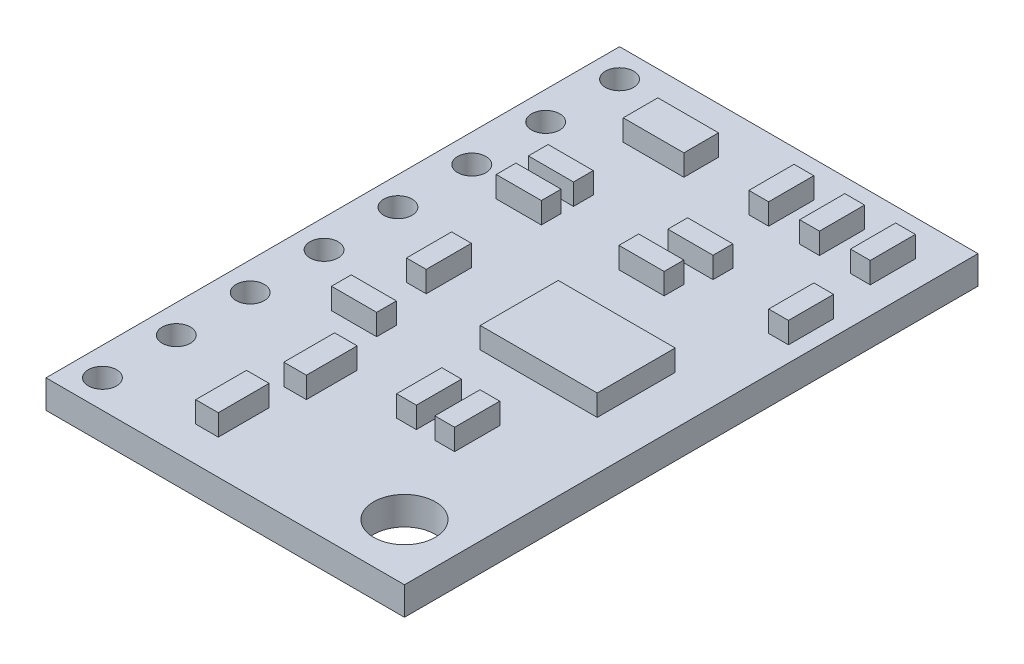
from build123d import *

# Parameters (mm, degrees)
SKETCH1_W           = 12.7
SKETCH1_H           = 20.32
BOSS_EXTRUDE1_DEPTH = 1
SKETCH2_R           = 0.5
SKETCH2_R_2         = 1.0922
CUT_EXTRUDE2_DEPTH  = 1
SKETCH3_W           = 0.7
SKETCH3_H           = 1.6
SKETCH3_W_2         = 2.149156966
SKETCH3_H_2         = 1.228089695
SKETCH3_W_3         = 4.14480272
SKETCH3_H_3         = 2.763201813
SKETCH3_W_4         = 0.8
SKETCH3_H_4         = 1.8
SKETCH3_W_5         = 1.6
SKETCH3_H_5         = 0.7
BOSS_EXTRUDE3_DEPTH = 0.75


with BuildPart() as part:
    # Sketch1 → Boss-Extrude1 (new body)
    with BuildSketch(Plane(origin=(0, 0, 0), x_dir=(1, 0, 0), z_dir=(0, 1, 0))):
        with Locations((6.35, 10.16)):
            Rectangle(SKETCH1_W, SKETCH1_H)
    extrude(amount=BOSS_EXTRUDE1_DEPTH)

    # Sketch2 → Cut-Extrude2 (cut)
    with BuildSketch(Plane(origin=(0, 1, 0), x_dir=(1, 0, 0), z_dir=(0, 1, 0))):
        with Locations((1, 19.32)):
            Circle(SKETCH2_R)
        with Locations((1, 16.702857143)):
            Circle(SKETCH2_R)
        with Locations((1, 14.085714286)):
            Circle(SKETCH2_R)
        with Locations((1, 11.468571429)):
            Circle(SKETCH2_R)
        with Locations((1, 8.851428571)):
            Circle(SKETCH2_R)
        with Locations((1, 6.234285714)):
            Circle(SKETCH2_R)
        with Locations((1, 3.617142857)):
            Circle(SKETCH2_R)
        with Locations((1, 1)):
            Circle(SKETCH2_R)
        with Locations((10.7, 2)):
            Circle(SKETCH2_R_2)
    extrude(amount=-CUT_EXTRUDE2_DEPTH, mode=Mode.SUBTRACT)

    # Sketch3 → Boss-Extrude3 (add)
    with BuildSketch(Plane(origin=(0, 1, 0), x_dir=(1, 0, 0), z_dir=(0, 1, 0))):
        with Locations((9.600163685, 18.251782562)):
            Rectangle(SKETCH3_W, SKETCH3_H)
        with Locations((4.072917024, 18.06582741)):
            Rectangle(SKETCH3_W_2, SKETCH3_H_2)
        with Locations((8.908520197, 9.929733183)):
            Rectangle(SKETCH3_W_3, SKETCH3_H_3)
        with Locations((4.882280256, 4.84279592)):
            Rectangle(SKETCH3_W_4, SKETCH3_H_4)
        with Locations((4.472917024, 2.130764511)):
            Rectangle(SKETCH3_W_4, SKETCH3_H_4)
        with Locations((7.800163685, 18.251782562)):
            Rectangle(SKETCH3_W, SKETCH3_H)
        with Locations((11.400163685, 18.251782562)):
            Rectangle(SKETCH3_W, SKETCH3_H)
        with Locations((11.791455193, 14.963159232)):
            Rectangle(SKETCH3_W, SKETCH3_H)
        with Locations((3.286634502, 14.952625597)):
            Rectangle(SKETCH3_W_5, SKETCH3_H_5)
        with Locations((3.286634502, 13.813159232)):
            Rectangle(SKETCH3_W_5, SKETCH3_H_5)
        with Locations((8.005018674, 15.176499715)):
            Rectangle(SKETCH3_W_5, SKETCH3_H_5)
        with Locations((7.636118837, 13.813159232)):
            Rectangle(SKETCH3_W_5, SKETCH3_H_5)
        with Locations((3.808428935, 10.112643834)):
            Rectangle(SKETCH3_W, SKETCH3_H)
        with Locations((7.800163685, 5.771046806)):
            Rectangle(SKETCH3_W, SKETCH3_H)
        with Locations((9.155018674, 5.771046806)):
            Rectangle(SKETCH3_W, SKETCH3_H)
        with Locations((3.798338541, 7.466211291)):
            Rectangle(SKETCH3_W_5, SKETCH3_H_5)
    extrude(amount=BOSS_EXTRUDE3_DEPTH)


solid = part.part
